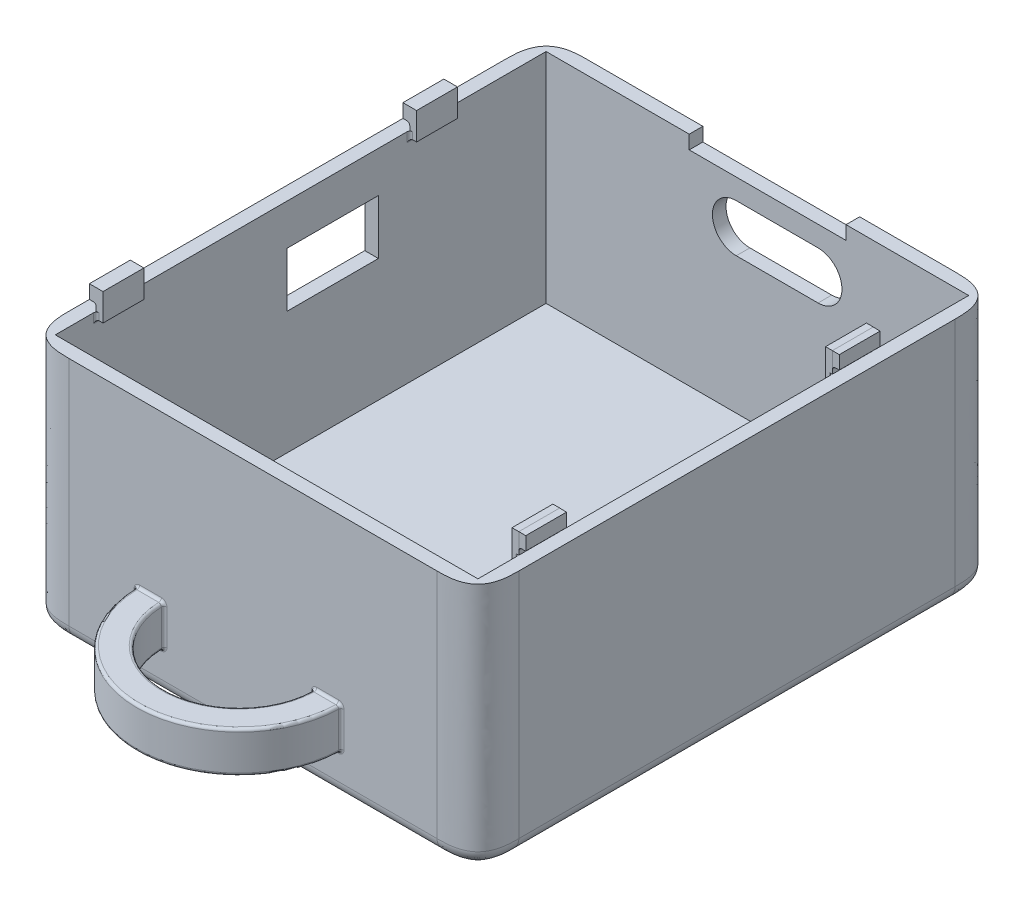
from build123d import *

# Parameters (mm, degrees)
SKETCH1_W              = 33
SKETCH1_H              = 38
BOTTOM_EXTRUDE_DEPTH   = 18
SID_CORNER_FILLET_SIZE = 3
BOTTOM_FILLET_R        = 1
SKETCH2_W              = 31
SKETCH2_H              = 36
CUT_EXTRUDE1_DEPTH     = 16
BOSS_EXTRUDE1_DEPTH    = 3
FILLET1_R              = 0.2
CUT_USB_REACH          = 158.434
SKETCH22_W             = 11.5
SKETCH22_H             = 1
SKETCH23_W             = 6.7
SKETCH23_H             = 4
CUT_BT_DEPTH           = 1
SKETCH24_W             = 3
SKETCH24_H             = 2
BOSS_CLIP_DEPTH        = 0.5
SKETCH26_W             = 3
SKETCH26_H             = 1
BOSS_CLIPEXT_DEPTH     = 0.5
BOSS_CLIPEXT_TAPER     = 1
FILLET2_R              = 0.2
LPATTERN2_COUNT        = 2
LPATTERN2_PITCH        = 23
FILLET2_OF_LPATTERN2_R = 0.2
SKETCH27_W             = 3
SKETCH27_H             = 2
BOSS_CLIP1_DEPTH       = 0.5
SKETCH28_W             = 3
SKETCH28_H             = 1
BOSS_CLIPEXT1_DEPTH    = 0.5
FILLET4_R              = 0.2
LPATTERN4_COUNT        = 2
LPATTERN4_PITCH        = 23
FILLET4_OF_LPATTERN4_R = 0.2


with BuildPart() as part:
    # Sketch1 → Bottom-Extrude (new body)
    with BuildSketch(Plane(origin=(0, 0, 0), x_dir=(1, 0, 0), z_dir=(0, 1, 0))):
        with Locations((-132.084269663, 77.775280899)):
            Rectangle(SKETCH1_W, SKETCH1_H)
    extrude(amount=BOTTOM_EXTRUDE_DEPTH)

    # Sid_Corner-Fillet
    # a fillet whose section is not a circle: 3 mm, written as the material it takes off along each edge
    with BuildSketch(Plane(origin=(-115.584269663, -7.5, -58.775280899), x_dir=(0, 0, -1), z_dir=(0, 1, 0)), Plane(origin=(-148.584269663, -7.5, -58.775280899), x_dir=(1, 0, 0), z_dir=(0, 1, 0)), Plane(origin=(-115.584269663, -7.5, -96.775280899), x_dir=(-1, 0, 0), z_dir=(0, 1, 0))) as sid_corner_fillet_piece_1:
        with BuildLine():
            add(Edge.make_bspline([(SID_CORNER_FILLET_SIZE, 0), (SID_CORNER_FILLET_SIZE * 0.831801948466, 0), (SID_CORNER_FILLET_SIZE * 0.663603896932, 0), (SID_CORNER_FILLET_SIZE * 0.292893218813, SID_CORNER_FILLET_SIZE * 0.0716919198361), (SID_CORNER_FILLET_SIZE * 0.0716919198361, SID_CORNER_FILLET_SIZE * 0.292893218813), (0, SID_CORNER_FILLET_SIZE * 0.663603896932), (0, SID_CORNER_FILLET_SIZE * 0.831801948466), (0, SID_CORNER_FILLET_SIZE)], knots=[0, 0, 0, 0, 0, 0, 0.5, 0.5, 1, 1, 1, 1, 1, 1], degree=5))
            Line((0, SID_CORNER_FILLET_SIZE), (0, 0))
            Line((0, 0), (SID_CORNER_FILLET_SIZE, 0))
        make_face()
    extrude(amount=33, mode=Mode.SUBTRACT)
    with BuildSketch(Plane(origin=(-148.584269663, -7.5, -96.775280899), x_dir=(1, 0, 0), z_dir=(0, 1, 0))) as sid_corner_fillet_piece_2:
        with BuildLine():
            add(Edge.make_bspline([(SID_CORNER_FILLET_SIZE, 0), (SID_CORNER_FILLET_SIZE * 0.831801948466, 0), (SID_CORNER_FILLET_SIZE * 0.663603896932, 0), (SID_CORNER_FILLET_SIZE * 0.292893218813, -SID_CORNER_FILLET_SIZE * 0.0716919198361), (SID_CORNER_FILLET_SIZE * 0.0716919198361, -SID_CORNER_FILLET_SIZE * 0.292893218813), (0, -SID_CORNER_FILLET_SIZE * 0.663603896932), (0, -SID_CORNER_FILLET_SIZE * 0.831801948466), (0, -SID_CORNER_FILLET_SIZE)], knots=[0, 0, 0, 0, 0, 0, 0.5, 0.5, 1, 1, 1, 1, 1, 1], degree=5))
            Line((0, -SID_CORNER_FILLET_SIZE), (0, 0))
            Line((0, 0), (SID_CORNER_FILLET_SIZE, 0))
        make_face()
    extrude(amount=33, mode=Mode.SUBTRACT)

    # Bottom-Fillet
    bottom_fillet_edges = [part.edges().sort_by_distance(p)[0] for p in [
        (-132.084269663, 0, -96.775280899),
        (-148.584269663, 0, -77.775280899),
        (-132.084269663, 0, -58.775280899),
        (-115.584269663, 0, -77.775280899),
        (-116.243279405, 0, -96.116271157),
        (-147.925259921, 0, -96.116271157),
        (-147.925259921, 0, -59.434290641),
        (-116.243279405, 0, -59.434290641),
    ]]
    fillet(bottom_fillet_edges, radius=BOTTOM_FILLET_R)

    # Sketch2 → Cut-Extrude1 (cut)
    with BuildSketch(Plane(origin=(0, 18, 0), x_dir=(1, 0, 0), z_dir=(0, 1, 0))):
        with Locations((-132.084269663, 77.775280899)):
            Rectangle(SKETCH2_W, SKETCH2_H)
    extrude(amount=-CUT_EXTRUDE1_DEPTH, mode=Mode.SUBTRACT)

    # Sketch21 → Boss-Extrude1 (add)
    with BuildSketch(Plane(origin=(0, 3, 0), x_dir=(-1, 0, 0), z_dir=(0, -1, 0))):
        with BuildLine():
            ThreePointArc((125.603064766, 58.775280899), (133.103064766, 51.275280899), (140.603064766, 58.775280899))
            Line((140.603064766, 58.775280899), (138.603064766, 58.775280899))
            ThreePointArc((138.603064766, 58.775280899), (133.103064766, 53.275280899), (127.603064766, 58.775280899))
            Line((127.603064766, 58.775280899), (125.603064766, 58.775280899))
        make_face()
    extrude(amount=-BOSS_EXTRUDE1_DEPTH)

    # Fillet1
    fillet1_edges = [part.edges().sort_by_distance(p)[0] for p in [
        (-133.103064766, 3, -53.275280899),
        (-127.603064766, 4.5, -58.775280899),
        (-139.603064766, 6, -58.775280899),
        (-138.603064766, 4.5, -58.775280899),
        (-133.103064766, 6, -51.275280899),
        (-140.603064766, 4.5, -58.775280899),
        (-126.603064766, 6, -58.775280899),
        (-125.603064766, 4.5, -58.775280899),
        (-133.103064766, 6, -53.275280899),
        (-126.603064766, 3, -58.775280899),
        (-133.103064766, 3, -51.275280899),
        (-139.603064766, 3, -58.775280899),
    ]]
    fillet(fillet1_edges, radius=FILLET1_R)

    # Sketch22 → Cut-USB (cut, up to next)
    with BuildSketch(Plane(origin=(0, 0, -96.775280899), x_dir=(-1, 0, 0), z_dir=(0, 0, -1)), mode=Mode.PRIVATE) as cut_usb_sk1:
        with BuildLine():
            Line((127.634269663, 15.5), (133.634269663, 15.5))
            ThreePointArc((133.634269663, 15.5), (135.384269663, 13.75), (133.634269663, 12))
            Line((133.634269663, 12), (127.634269663, 12))
            ThreePointArc((127.634269663, 12), (125.884269663, 13.75), (127.634269663, 15.5))
        make_face()
    cut_usb_tool1 = extrude(cut_usb_sk1.sketch, amount=-CUT_USB_REACH, mode=Mode.PRIVATE) & part.part
    # Sketch22 → Cut-USB (cut, up to next)
    with BuildSketch(Plane(origin=(0, 0, -96.775280899), x_dir=(-1, 0, 0), z_dir=(0, 0, -1)), mode=Mode.PRIVATE) as cut_usb_sk2:
        with Locations((131.334269663, 17.5)):
            Rectangle(SKETCH22_W, SKETCH22_H)
    cut_usb_tool2 = extrude(cut_usb_sk2.sketch, amount=-CUT_USB_REACH, mode=Mode.PRIVATE) & part.part
    add(cut_usb_tool1.solids().sort_by_distance((-130.63427, 13.75, -96.775281))[0], mode=Mode.SUBTRACT)
    add(cut_usb_tool2.solids().sort_by_distance((-131.33427, 17.5, -96.775281))[0], mode=Mode.SUBTRACT)

    # Sketch23 → Cut-BT (cut)
    with BuildSketch(Plane.ZY.offset(148.584269663)):
        with Locations((-80.125280899, 13)):
            Rectangle(SKETCH23_W, SKETCH23_H)
    extrude(amount=-CUT_BT_DEPTH, mode=Mode.SUBTRACT)

    # Sketch24 → Boss-Clip (add)
    with BuildSketch(Plane.ZY.offset(116.584269663)):
        with Locations((-64.275280899, 18.5)):
            Rectangle(SKETCH24_W, SKETCH24_H)
    boss_clip = extrude(amount=BOSS_CLIP_DEPTH)

    # Sketch26 → Boss-ClipExt (add)
    with BuildSketch(Plane(origin=(-116.584269663, 0, 0), x_dir=(0, 0, -1), z_dir=(1, 0, 0))):
        with Locations((64.275280899, 19)):
            Rectangle(SKETCH26_W, SKETCH26_H)
    boss_clipext = extrude(amount=BOSS_CLIPEXT_DEPTH, taper=BOSS_CLIPEXT_TAPER)

    # Fillet2
    fillet2_edges = [part.edges().sort_by_distance(p)[0] for p in [
        (-116.584269663, 17.75, -65.775280899),
        (-116.584269663, 17.75, -62.775280899),
        (-116.584269663, 17.5, -64.275280899),
        (-116.584269663, 18.5, -64.275280899),
    ]]
    fillet(fillet2_edges, radius=FILLET2_R)

    # LPattern2: Boss-Clip, Boss-ClipExt ×2
    with Locations(*[(0, 0, -i * LPATTERN2_PITCH) for i in range(1, LPATTERN2_COUNT)]):
        add(boss_clip)
        add(boss_clipext)

    # Fillet2 of LPattern2
    fillet2_of_lpattern2_edges = [part.edges().sort_by_distance(p)[0] for p in [
        (-116.584269663, 17.75, -88.775280899),
        (-116.584269663, 17.75, -85.775280899),
        (-116.584269663, 17.5, -87.275280899),
        (-116.584269663, 18.5, -87.275280899),
    ]]
    fillet(fillet2_of_lpattern2_edges, radius=FILLET2_OF_LPATTERN2_R)

    # Sketch27 → Boss-Clip1 (add)
    with BuildSketch(Plane(origin=(-147.584269663, 0, 0), x_dir=(0, 0, -1), z_dir=(1, 0, 0))):
        with Locations((64.275280899, 18.5)):
            Rectangle(SKETCH27_W, SKETCH27_H)
    boss_clip1 = extrude(amount=BOSS_CLIP1_DEPTH)

    # Sketch28 → Boss-ClipExt1 (add)
    with BuildSketch(Plane.ZY.offset(147.584269663)):
        with Locations((-64.275280899, 19)):
            Rectangle(SKETCH28_W, SKETCH28_H)
    boss_clipext1 = extrude(amount=BOSS_CLIPEXT1_DEPTH)

    # Fillet4
    fillet4_edges = [part.edges().sort_by_distance(p)[0] for p in [
        (-147.584269663, 18.5, -64.275280899),
        (-147.584269663, 17.75, -65.775280899),
        (-147.584269663, 17.5, -64.275280899),
        (-147.584269663, 17.75, -62.775280899),
    ]]
    fillet(fillet4_edges, radius=FILLET4_R)

    # LPattern4: Boss-Clip1, Boss-ClipExt1 ×2
    with Locations(*[(0, 0, -i * LPATTERN4_PITCH) for i in range(1, LPATTERN4_COUNT)]):
        add(boss_clip1)
        add(boss_clipext1)

    # Fillet4 of LPattern4
    fillet4_of_lpattern4_edges = [part.edges().sort_by_distance(p)[0] for p in [
        (-147.584269663, 18.5, -87.275280899),
        (-147.584269663, 17.75, -88.775280899),
        (-147.584269663, 17.5, -87.275280899),
        (-147.584269663, 17.75, -85.775280899),
    ]]
    fillet(fillet4_of_lpattern4_edges, radius=FILLET4_OF_LPATTERN4_R)


solid = part.part
